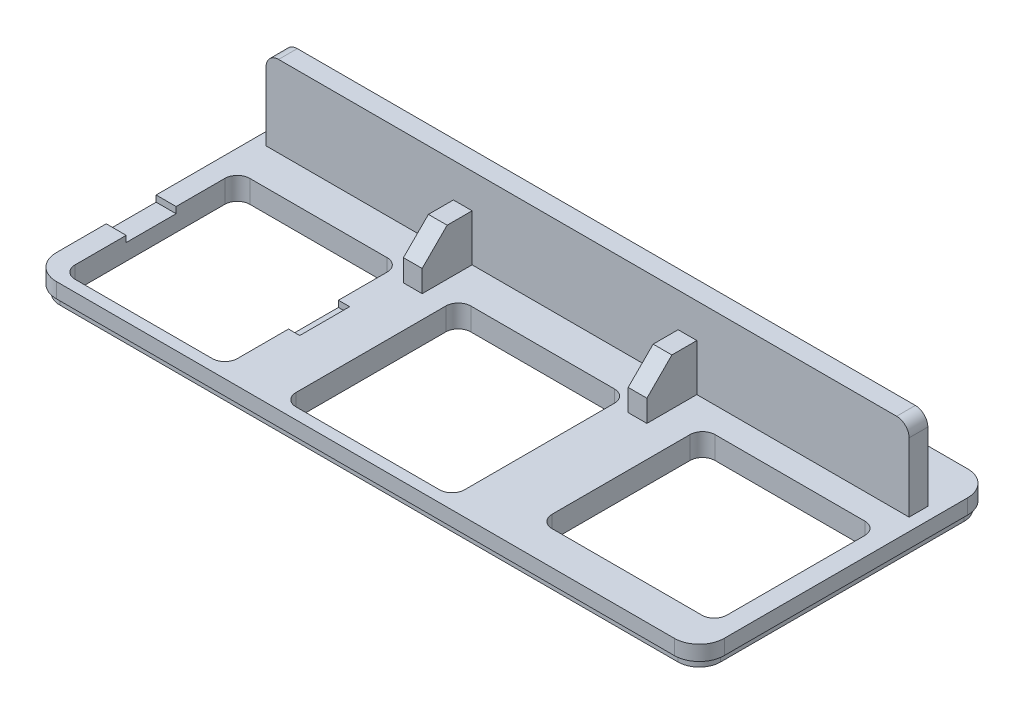
from build123d import *

# Parameters (mm, degrees)
SKETCH_1_W          = 53.5
SKETCH_1_H          = 23.5
EXTRUDE_1_DEPTH     = 1.2
FILLET_1_R          = 2
EXTRUDE_2_DEPTH     = 0.6
SKETCH_3_W          = 13
SKETCH_3_H          = 14
SKETCH_3_W_2        = 13.5
SKETCH_3_W_3        = 14
SKETCH_3_H_2        = 13.05
CUT_EXTRUDE_1_DEPTH = 3
FILLET_2_R          = 1
SKETCH_4_W          = 15.5
SKETCH_4_H          = 3.997435945
CUT_EXTRUDE_2_DEPTH = 0.5
SKETCH_5_W          = 51.5
SKETCH_5_H          = 1.5
EXTRUDE_3_DEPTH     = 6.5
FILLET_3_R          = 1
SKETCH_6_W          = 1.5
SKETCH_6_H          = 4
EXTRUDE_4_DEPTH     = 3.75
CHAMFER_1_SIZE      = 2


with BuildPart() as part:
    # 草图1 → 凸台-拉伸1 (new body)
    with BuildSketch(Plane(origin=(0, 0, 0), x_dir=(1, 0, 0), z_dir=(0, 1, 0))):
        Rectangle(SKETCH_1_W, SKETCH_1_H)
    extrude(amount=EXTRUDE_1_DEPTH)

    # 圆角1
    fillet_1_edges = [part.edges().sort_by_distance(p)[0] for p in [
        (-26.75, 0.6, 11.75),
        (26.75, 0.6, 11.75),
        (-26.75, 0.6, -11.75),
        (26.75, 0.6, -11.75),
    ]]
    fillet(fillet_1_edges, radius=FILLET_1_R)

    # 草图2 → 凸台-拉伸2 (add)
    with BuildSketch(Plane.XZ):
        with BuildLine():
            Line((24.75, 11.45), (-24.75, 11.45))
            ThreePointArc((-24.75, 11.45), (-25.952081528, 10.952081528), (-26.45, 9.75))
            Line((-26.45, 9.75), (-26.45, -9.75))
            ThreePointArc((-26.45, -9.75), (-25.952081528, -10.952081528), (-24.75, -11.45))
            Line((-24.75, -11.45), (24.75, -11.45))
            ThreePointArc((24.75, -11.45), (25.952081528, -10.952081528), (26.45, -9.75))
            Line((26.45, -9.75), (26.45, 9.75))
            ThreePointArc((26.45, 9.75), (25.952081528, 10.952081528), (24.75, 11.45))
        make_face()
    extrude(amount=EXTRUDE_2_DEPTH)

    # 草图3 → 切除-拉伸1 (cut)
    with BuildSketch(Plane.XZ.offset(0.6)):
        with Locations((-18.65, 3.85)):
            Rectangle(SKETCH_3_W, SKETCH_3_H)
        with Locations((-0.7, 3.85)):
            Rectangle(SKETCH_3_W_2, SKETCH_3_H)
        with Locations((18.25, 2.516421356)):
            Rectangle(SKETCH_3_W_3, SKETCH_3_H_2)
    extrude(amount=-CUT_EXTRUDE_1_DEPTH, mode=Mode.SUBTRACT)

    # 圆角2
    fillet_2_edges = [part.edges().sort_by_distance(p)[0] for p in [
        (-25.15, 0.3, 10.85),
        (-12.15, 0.3, 10.85),
        (-7.45, 0.3, 10.85),
        (6.05, 0.3, 10.85),
        (25.25, 0.3, 9.041421356),
        (11.25, 0.3, 9.041421356),
        (25.25, 0.3, -4.008578644),
        (11.25, 0.3, -4.008578644),
        (6.05, 0.3, -3.15),
        (-7.45, 0.3, -3.15),
        (-12.15, 0.3, -3.15),
        (-25.15, 0.3, -3.15),
    ]]
    fillet(fillet_2_edges, radius=FILLET_2_R)

    # 草图4 → 切除-拉伸2 (cut)
    with BuildSketch(Plane(origin=(0, 1.2, 0), x_dir=(1, 0, 0), z_dir=(0, 1, 0))):
        with Locations((-19, -3.751282028)):
            Rectangle(SKETCH_4_W, SKETCH_4_H)
    extrude(amount=-CUT_EXTRUDE_2_DEPTH, mode=Mode.SUBTRACT)

    # 草图5 → 凸台-拉伸3 (add)
    with BuildSketch(Plane(origin=(0, 1.2, 0), x_dir=(1, 0, 0), z_dir=(0, 1, 0))):
        with Locations((0, 6.804632487)):
            Rectangle(SKETCH_5_W, SKETCH_5_H)
    extrude(amount=EXTRUDE_3_DEPTH)

    # 圆角3
    fillet_3_edges = [part.edges().sort_by_distance(p)[0] for p in [
        (-25.75, 7.7, -6.804632487),
        (25.75, 7.7, -6.804632487),
    ]]
    fillet(fillet_3_edges, radius=FILLET_3_R)

    # 草图6 → 凸台-拉伸4 (add)
    with BuildSketch(Plane(origin=(0, 1.2, 0), x_dir=(1, 0, 0), z_dir=(0, 1, 0))):
        with Locations((8, 4.054632487)):
            Rectangle(SKETCH_6_W, SKETCH_6_H)
        with Locations((-10, 4.054632487)):
            Rectangle(SKETCH_6_W, SKETCH_6_H)
    extrude(amount=EXTRUDE_4_DEPTH)

    # 倒角1
    chamfer_1_edges = [part.edges().sort_by_distance(p)[0] for p in [
        (-10, 4.95, -2.054632487),
        (8, 4.95, -2.054632487),
    ]]
    chamfer(chamfer_1_edges, length=CHAMFER_1_SIZE)


solid = part.part
